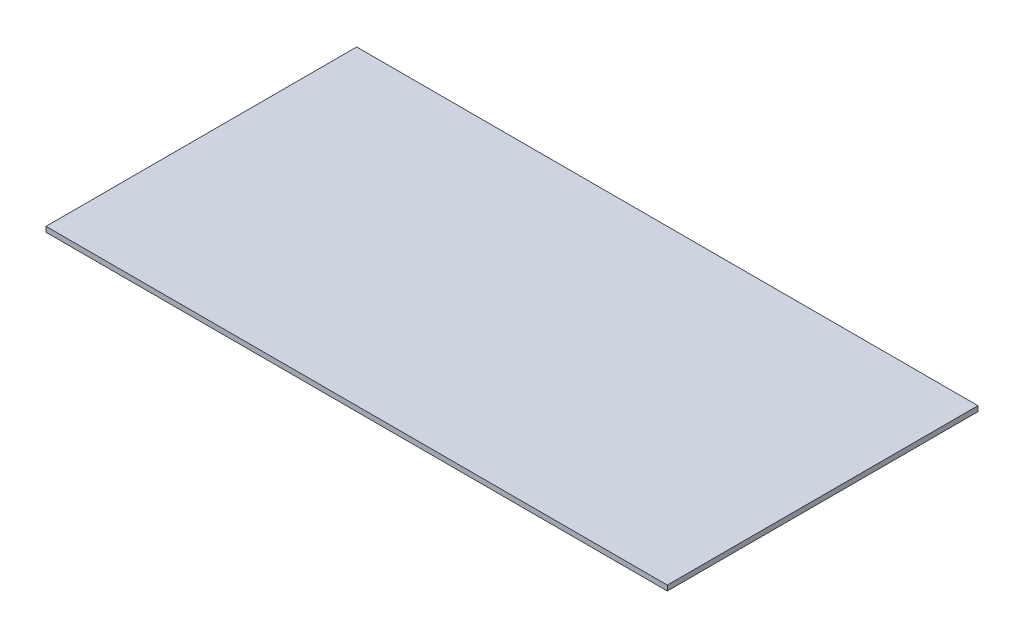
from build123d import *

# Parameters (mm, degrees)
SKETCH1_W           = 381
SKETCH1_H           = 190.5
BOSS_EXTRUDE1_DEPTH = 3.175


with BuildPart() as part:
    # Sketch1 → Boss-Extrude1 (new body)
    with BuildSketch(Plane(origin=(0, 0, 0), x_dir=(1, 0, 0), z_dir=(0, 1, 0))):
        Rectangle(SKETCH1_W, SKETCH1_H)
    extrude(amount=BOSS_EXTRUDE1_DEPTH)


solid = part.part
